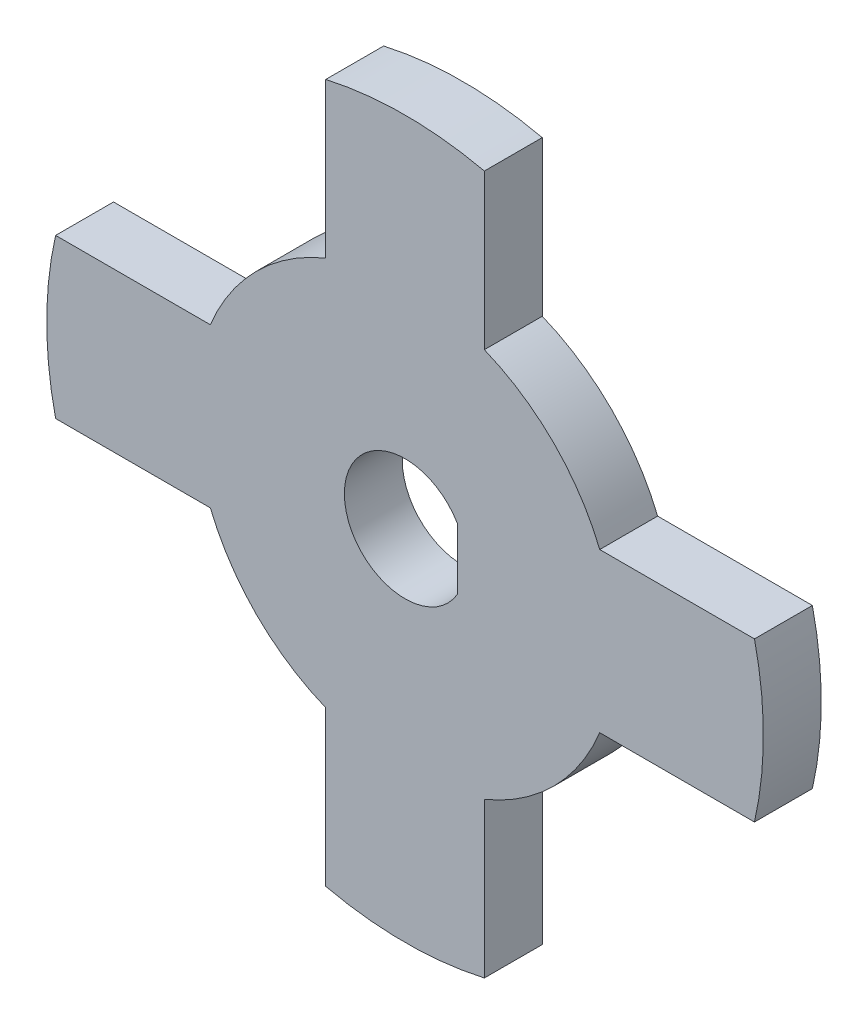
from build123d import *

# Parameters (mm, degrees)
BOSS_EXTRUDE1_DEPTH = 3.03


with BuildPart() as part:
    # Sketch3 → Boss-Extrude1 (new body)
    with BuildSketch(Plane.XY):
        with BuildLine():
            Line((4.15, 18.284966503), (4.15, 10.187124226))
            ThreePointArc((4.15, 10.187124226), (7.778174593, 7.778174593), (10.187124226, 4.15))
            Line((10.187124226, 4.15), (18.284966503, 4.15))
            ThreePointArc((18.284966503, 4.15), (18.75, 0), (18.284966503, -4.15))
            Line((18.284966503, -4.15), (10.187124226, -4.15))
            ThreePointArc((10.187124226, -4.15), (7.778174593, -7.778174593), (4.15, -10.187124226))
            Line((4.15, -10.187124226), (4.15, -18.284966503))
            ThreePointArc((4.15, -18.284966503), (0, -18.75), (-4.15, -18.284966503))
            Line((-4.15, -18.284966503), (-4.15, -10.187124226))
            ThreePointArc((-4.15, -10.187124226), (-7.778174593, -7.778174593), (-10.187124226, -4.15))
            Line((-10.187124226, -4.15), (-18.284966503, -4.15))
            ThreePointArc((-18.284966503, -4.15), (-18.75, 0), (-18.284966503, 4.15))
            Line((-18.284966503, 4.15), (-10.187124226, 4.15))
            ThreePointArc((-10.187124226, 4.15), (-7.778174593, 7.778174593), (-4.15, 10.187124226))
            Line((-4.15, 10.187124226), (-4.15, 18.284966503))
            ThreePointArc((-4.15, 18.284966503), (0, 18.75), (4.15, 18.284966503))
        make_face()
        with BuildLine():
            Line((2.749630657, 1.5875), (2.749630657, -1.5875))
            ThreePointArc((2.749630657, -1.5875), (-3.175, 0), (2.749630657, 1.5875))
        make_face(mode=Mode.SUBTRACT)
    extrude(amount=BOSS_EXTRUDE1_DEPTH)


solid = part.part
